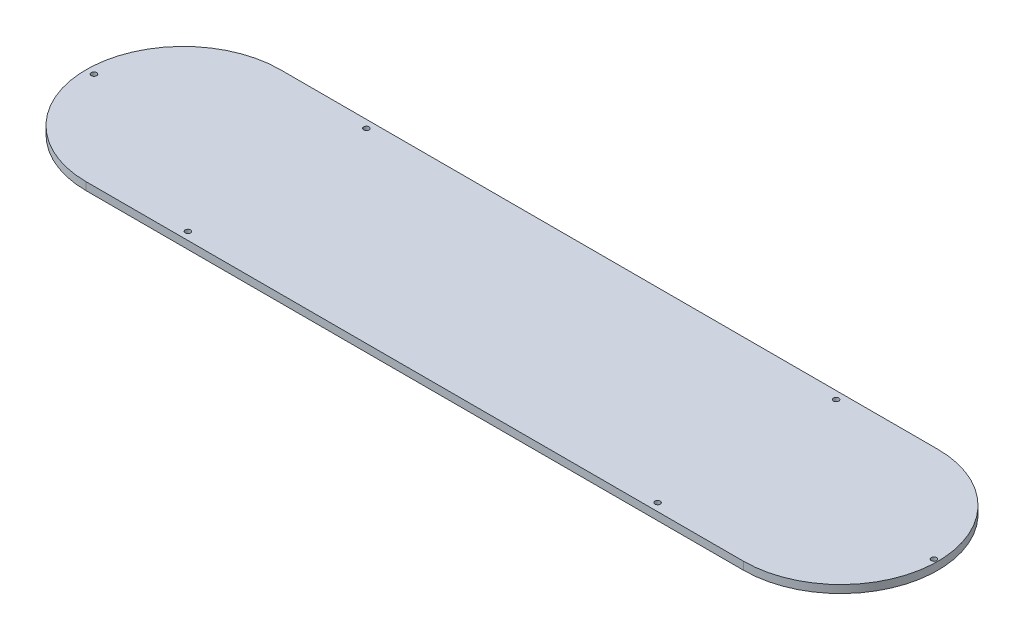
from build123d import *

# Parameters (mm, degrees)
SKETCH1_R           = 1.0922
BOSS_EXTRUDE1_DEPTH = 3.175


with BuildPart() as part:
    # Sketch1 → Boss-Extrude1 (new body)
    with BuildSketch(Plane(origin=(0, 0, 0), x_dir=(1, 0, 0), z_dir=(0, 1, 0))):
        with BuildLine():
            Line((0, 39.37), (266.7, 39.37))
            ThreePointArc((266.7, 39.37), (306.07, 0), (266.7, -39.37))
            Line((266.7, -39.37), (0, -39.37))
            ThreePointArc((0, -39.37), (-39.37, 0), (0, 39.37))
        make_face()
        with Locations((38.1, 36.195)):
            Circle(SKETCH1_R, mode=Mode.SUBTRACT)
        with Locations((228.6, 36.195)):
            Circle(SKETCH1_R, mode=Mode.SUBTRACT)
        with Locations((38.1, -36.195)):
            Circle(SKETCH1_R, mode=Mode.SUBTRACT)
        with Locations((228.6, -36.195)):
            Circle(SKETCH1_R, mode=Mode.SUBTRACT)
        with Locations((-36.195, 0)):
            Circle(SKETCH1_R, mode=Mode.SUBTRACT)
        with Locations((304.4825, 0)):
            Circle(SKETCH1_R, mode=Mode.SUBTRACT)
    extrude(amount=BOSS_EXTRUDE1_DEPTH)


solid = part.part
